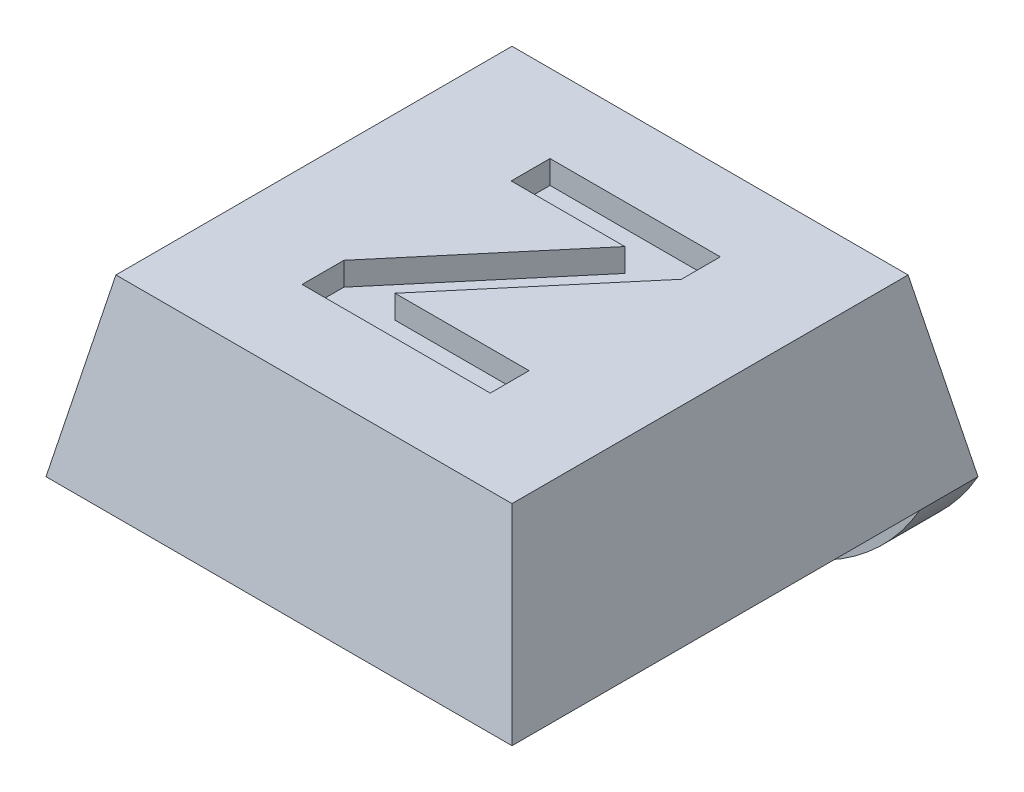
from build123d import *

# Parameters (mm, degrees)
SKETCH1_W               = 8
SKETCH1_H               = 8
BOSS_EXTRUDE1_DEPTH     = 3
CUT_EXTRUDE1_DEPTH      = 12.704699911
CUT_EXTRUDE1_DEPTH_BACK = 12.704699911
CUT_EXTRUDE2_DEPTH      = 11
SKETCH4_R               = 1.8
CUT_EXTRUDE3_DEPTH      = 0.8
SKETCH5_W               = 8
SKETCH5_H               = 1
BOSS_EXTRUDE2_DEPTH     = 2
FILLET1_R               = 4
CUT_EXTRUDE4_DEPTH      = 0.4


with BuildPart() as part:
    # Sketch1 → Boss-Extrude1 (new body)
    with BuildSketch(Plane(origin=(0, 0, 0), x_dir=(1, 0, 0), z_dir=(0, 1, 0))):
        with Locations((4, 4)):
            Rectangle(SKETCH1_W, SKETCH1_H)
    extrude(amount=BOSS_EXTRUDE1_DEPTH)

    # Sketch2 → Cut-Extrude1 (cut, two sides: drawn at the far end of the back side and taken through both)
    with BuildSketch(Plane.XY.offset(-CUT_EXTRUDE1_DEPTH_BACK)):
        Polygon((0, 0), (0.6, 3), (0, 3), align=None)
        Polygon((8, 0), (7.4, 3), (8, 3), align=None)
    extrude(amount=CUT_EXTRUDE1_DEPTH + CUT_EXTRUDE1_DEPTH_BACK, mode=Mode.SUBTRACT)

    # Sketch3 → Cut-Extrude2 (cut)
    with BuildSketch(Plane(origin=(0, 0, 0), x_dir=(0, 0, -1), z_dir=(1, 0, 0))):
        Polygon((0, 0), (0.6, 3), (0, 3), align=None)
        Polygon((8, 3), (7.4, 3), (8, 0), align=None)
    extrude(amount=CUT_EXTRUDE2_DEPTH, mode=Mode.SUBTRACT)

    # Sketch4 → Cut-Extrude3 (cut)
    with BuildSketch(Plane.XZ):
        with Locations(Location((4, -3.75, 0), (0, 0, 270))):
            Circle(SKETCH4_R)
    extrude(amount=-CUT_EXTRUDE3_DEPTH, mode=Mode.SUBTRACT)

    # Sketch5 → Boss-Extrude2 (add)
    with BuildSketch(Plane.XZ):
        with Locations((4, -7.5)):
            Rectangle(SKETCH5_W, SKETCH5_H)
    extrude(amount=BOSS_EXTRUDE2_DEPTH)

    # Fillet1
    # the kernel refuses this fillet: 4 mm, written as the material it takes off along each edge
    with BuildSketch(Plane(origin=(8, -2, -16.660254038), x_dir=(0, 1, 0), z_dir=(0, 0, 1)), Plane(origin=(0, -2, 1.660254038), x_dir=(0, 1, 0), z_dir=(0, 0, -1))) as fillet1_piece_1:
        with BuildLine():
            CenterArc((4, 3.464101615), FILLET1_R, 180, 60)
            Line((0, 3.464101615), (-0.08, 3.464101615))
            Line((-0.08, 3.464101615), (-0.08, 0))
            Line((-0.08, 0), (0, -0.08))
            ThreePointArc((0, -0.08), (1, -0.08), (1.96, -0.069282032))
            Line((1.96, -0.069282032), (2, 0))
        make_face()
    extrude(amount=18.320508076, mode=Mode.SUBTRACT)

    # Sketch6 → Cut-Extrude4 (cut)
    with BuildSketch(Plane(origin=(0, 3, 0), x_dir=(1, 0, 0), z_dir=(0, 1, 0))):
        Polygon((2.33946821, 2.056832464), (2.33946821, 2.774781182), (4.546198979, 5.390165797), (2.595878466, 5.390165797), (2.595878466, 6.056832464), (5.518955389, 6.056832464), (5.518955389, 5.390165797), (3.268154107, 2.72349913), (5.570237441, 2.72349913), (5.570237441, 2.056832464), align=None)
    extrude(amount=-CUT_EXTRUDE4_DEPTH, mode=Mode.SUBTRACT)


solid = part.part
